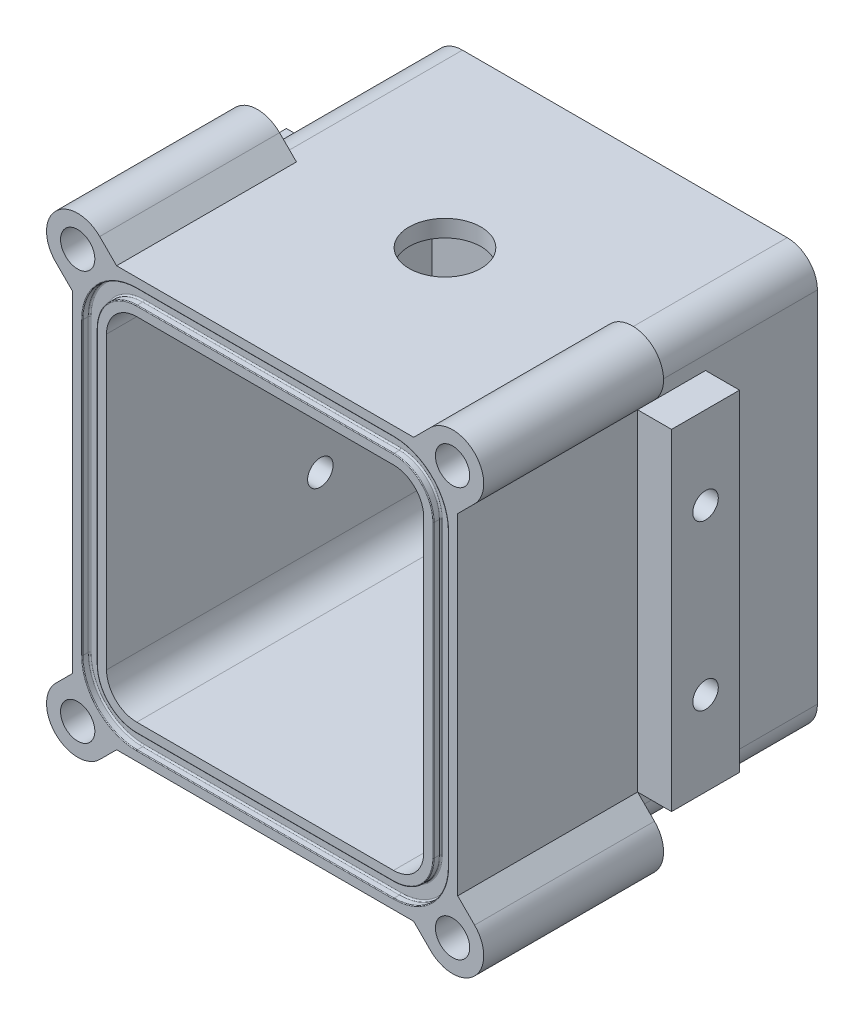
from build123d import *

# Parameters (mm, degrees)
BOSS_EXTRUDE1_DEPTH           = 31.75
SHELL1_T                      = -6
FILLET1_R                     = 5.334
CUT_EXTRUDE1_DEPTH            = 1.2954
FILLET2_R                     = 0.254
FILLET3_R                     = 0.127
BOSS_EXTRUDE2_DEPTH           = 31.75
SKETCH4_R                     = 3.025
CUT_EXTRUDE2_DEPTH            = 9
MIRROR2_COPY_1_DEPTH          = 31.75
MIRROR2_COPY_2_SKETCH_R       = 3.025
MIRROR2_COPY_2_DEPTH          = 9
SKETCH6_R                     = 6.35
CUT_EXTRUDE3_DEPTH            = 6
CUT_EXTRUDE4_START            = -3
SKETCH7_R                     = 11.43
SKETCH7_R_2                   = 6.35
CUT_EXTRUDE4_DEPTH            = 3
BOSS_EXTRUDE3_DEPTH           = 6
SKETCH9_R                     = 2
CUT_EXTRUDE5_DEPTH            = 4
SKETCH11_W                    = 2.25
SKETCH11_H                    = 76
M4_CLEARANCE_HOLE1_AT_2_COUNT = 2
M4_CLEARANCE_HOLE1_AT_2_PITCH = 28.96399232


with BuildPart() as part:
    # Sketch1 → Boss-Extrude1 (new, symmetric)
    with BuildSketch(Plane.XY):
        Polygon((-34, -37), (-34, -16.68), (-34, 16.68), (-34, 37), (34, 37), (34, -37), align=None)
    extrude(amount=BOSS_EXTRUDE1_DEPTH, both=True)

    # Shell1
    shell1_openings = [part.faces().sort_by_distance(p)[0] for p in [
        (0, 0, 31.75),
    ]]
    offset(amount=SHELL1_T, openings=shell1_openings, kind=Kind.INTERSECTION)

    # Fillet1
    fillet1_edges = [part.edges().sort_by_distance(p)[0] for p in [
        (34, 37, 0),
        (34, -37, 0),
        (-34, -37, 0),
        (-34, 37, 0),
        (28, 31, 3),
        (28, -31, 3),
        (-28, -31, 3),
        (-28, 31, 3),
    ]]
    fillet(fillet1_edges, radius=FILLET1_R)

    # Sketch2 → Cut-Extrude1 (cut)
    with BuildSketch(Plane.XY.offset(31.75)):
        with BuildLine():
            Line((32.2827, -25.666), (32.2827, 25.666))
            ThreePointArc((32.2827, 25.666), (29.466033783, 32.466033783), (22.666, 35.2827))
            Line((22.666, 35.2827), (-22.666, 35.2827))
            ThreePointArc((-22.666, 35.2827), (-29.466033783, 32.466033783), (-32.2827, 25.666))
            Line((-32.2827, 25.666), (-32.2827, -25.666))
            ThreePointArc((-32.2827, -25.666), (-29.466033783, -32.466033783), (-22.666, -35.2827))
            Line((-22.666, -35.2827), (22.666, -35.2827))
            ThreePointArc((22.666, -35.2827), (29.466033783, -32.466033783), (32.2827, -25.666))
        make_face()
        with BuildLine():
            Line((-29.7173, 25.666), (-29.7173, -25.666))
            ThreePointArc((-29.7173, -25.666), (-27.652022046, -30.652022046), (-22.666, -32.7173))
            Line((-22.666, -32.7173), (22.666, -32.7173))
            ThreePointArc((22.666, -32.7173), (27.652022046, -30.652022046), (29.7173, -25.666))
            Line((29.7173, -25.666), (29.7173, 25.666))
            ThreePointArc((29.7173, 25.666), (27.652022046, 30.652022046), (22.666, 32.7173))
            Line((22.666, 32.7173), (-22.666, 32.7173))
            ThreePointArc((-22.666, 32.7173), (-27.652022046, 30.652022046), (-29.7173, 25.666))
        make_face(mode=Mode.SUBTRACT)
    extrude(amount=-CUT_EXTRUDE1_DEPTH, mode=Mode.SUBTRACT)

    # Fillet2
    fillet2_edges = [part.edges().sort_by_distance(p)[0] for p in [
        (27.652022046, -30.652022046, 30.4546),
        (0, -32.7173, 30.4546),
        (-27.652022046, -30.652022046, 30.4546),
        (-29.7173, 0, 30.4546),
        (-27.652022046, 30.652022046, 30.4546),
        (0, 32.7173, 30.4546),
        (27.652022046, 30.652022046, 30.4546),
        (-29.466033783, 32.466033783, 30.4546),
        (0, 35.2827, 30.4546),
        (29.466033783, 32.466033783, 30.4546),
        (32.2827, 0, 30.4546),
        (29.466033783, -32.466033783, 30.4546),
        (0, -35.2827, 30.4546),
        (-29.466033783, -32.466033783, 30.4546),
        (29.7173, 0, 30.4546),
        (-32.2827, 0, 30.4546),
    ]]
    fillet(fillet2_edges, radius=FILLET2_R)

    # Fillet3
    fillet3_edges = [part.edges().sort_by_distance(p)[0] for p in [
        (-29.466033783, -32.466033783, 31.75),
        (-32.2827, 0, 31.75),
        (-29.466033783, 32.466033783, 31.75),
        (0, 35.2827, 31.75),
        (29.466033783, 32.466033783, 31.75),
        (32.2827, 0, 31.75),
        (29.466033783, -32.466033783, 31.75),
        (-27.652022046, -30.652022046, 31.75),
        (-29.7173, 0, 31.75),
        (-27.652022046, 30.652022046, 31.75),
        (0, 32.7173, 31.75),
        (27.652022046, 30.652022046, 31.75),
        (29.7173, 0, 31.75),
        (27.652022046, -30.652022046, 31.75),
        (0, -35.2827, 31.75),
        (0, -32.7173, 31.75),
    ]]
    fillet(fillet3_edges, radius=FILLET3_R)

    # Sketch3 → Boss-Extrude2 (add)
    with BuildSketch(Plane.XY.offset(31.75)):
        with BuildLine():
            ThreePointArc((30.741024965, -31.118858104), (29.555836344, -32.555836344), (28.118858104, -33.741024965))
            ThreePointArc((28.118858104, -33.741024965), (27.643498403, -35.335928432), (27.666944752, -37))
            Line((27.666944752, -37), (26.221825407, -37))
            Line((26.221825407, -37), (29.202282953, -39.980457546))
            ThreePointArc((29.202282953, -39.980457546), (36.980457546, -39.980457546), (36.980457546, -32.202282953))
            Line((36.980457546, -32.202282953), (34, -29.221825407))
            Line((34, -29.221825407), (34, -30.666944752))
            ThreePointArc((34, -30.666944752), (32.335928432, -30.643498403), (30.741024965, -31.118858104))
        make_face()
    boss_extrude2 = extrude(amount=-BOSS_EXTRUDE2_DEPTH)

    # Sketch4 → Cut-Extrude2 (cut)
    with BuildSketch(Plane.XY.offset(31.75)):
        with Locations((33.09137025, -36.09137025)):
            Circle(SKETCH4_R)
    cut_extrude2 = extrude(amount=-CUT_EXTRUDE2_DEPTH, mode=Mode.SUBTRACT)

    # Mirror1: Boss-Extrude2, Cut-Extrude2 across plane
    add(boss_extrude2.mirror(Plane.ZX))
    add(cut_extrude2.mirror(Plane.ZX), mode=Mode.SUBTRACT)

    # Mirror2: Boss-Extrude2, Cut-Extrude2 across plane
    add(boss_extrude2.mirror(Plane(origin=(0, 0, 0), x_dir=(0, 0, 1), z_dir=(1, 0, 0))))
    add(cut_extrude2.mirror(Plane(origin=(0, 0, 0), x_dir=(0, 0, 1), z_dir=(1, 0, 0))), mode=Mode.SUBTRACT)

    # Mirror2 copy 1 sketch → Mirror2 copy 1 (add)
    with BuildSketch(Plane(origin=(0, 0, 31.75), x_dir=(-1, 0, 0), z_dir=(0, 0, 1))):
        with BuildLine():
            ThreePointArc((30.741024965, -31.118858104), (29.555836344, -32.555836344), (28.118858104, -33.741024965))
            ThreePointArc((28.118858104, -33.741024965), (27.643498403, -35.335928432), (27.666944752, -37))
            Line((27.666944752, -37), (26.221825407, -37))
            Line((26.221825407, -37), (29.202282953, -39.980457546))
            ThreePointArc((29.202282953, -39.980457546), (36.980457546, -39.980457546), (36.980457546, -32.202282953))
            Line((36.980457546, -32.202282953), (34, -29.221825407))
            Line((34, -29.221825407), (34, -30.666944752))
            ThreePointArc((34, -30.666944752), (32.335928432, -30.643498403), (30.741024965, -31.118858104))
        make_face()
    extrude(amount=-MIRROR2_COPY_1_DEPTH)

    # Mirror2 copy 2 sketch → Mirror2 copy 2 (cut)
    with BuildSketch(Plane(origin=(0, 0, 31.75), x_dir=(-1, 0, 0), z_dir=(0, 0, 1))):
        with Locations((33.09137025, -36.09137025)):
            Circle(MIRROR2_COPY_2_SKETCH_R)
    extrude(amount=-MIRROR2_COPY_2_DEPTH, mode=Mode.SUBTRACT)

    # Sketch6 → Cut-Extrude3 (cut)
    with BuildSketch(Plane(origin=(0, 37, 0), x_dir=(1, 0, 0), z_dir=(0, 1, 0))):
        Circle(SKETCH6_R)
    extrude(amount=-CUT_EXTRUDE3_DEPTH, mode=Mode.SUBTRACT)

    # Sketch7 → Cut-Extrude4 (cut)
    with BuildSketch(Plane.XZ.offset(-31).offset(CUT_EXTRUDE4_START)):
        Circle(SKETCH7_R)
        Circle(SKETCH7_R_2, mode=Mode.SUBTRACT)
    extrude(amount=CUT_EXTRUDE4_DEPTH, mode=Mode.SUBTRACT)

    # Sketch8 → Boss-Extrude3 (add)
    with BuildSketch(Plane.ZY.offset(34)):
        Polygon((0, 0), (0, 29.221825407), (-12, 29.221825407), (-12, -29.221825407), (0, -29.221825407), align=None)
    boss_extrude3 = extrude(amount=BOSS_EXTRUDE3_DEPTH)

    # Sketch9 → Cut-Extrude5 (cut)
    with BuildSketch(Plane.ZY.offset(40)):
        with Locations((-6, 14.610912703)):
            Circle(SKETCH9_R)
        with Locations((-6, -14.353079617)):
            Circle(SKETCH9_R)
    cut_extrude5 = extrude(amount=-CUT_EXTRUDE5_DEPTH, mode=Mode.SUBTRACT)

    # Mirror5: Boss-Extrude3 across plane
    add(boss_extrude3.mirror(Plane(origin=(0, 0, 0), x_dir=(0, 0, 1), z_dir=(1, 0, 0))))

    # Mirror6: Cut-Extrude5 across plane
    add(cut_extrude5.mirror(Plane(origin=(0, 0, 0), x_dir=(0, 0, 1), z_dir=(1, 0, 0))), mode=Mode.SUBTRACT)

    # Sketch11 → M4 Clearance Hole1 (revolve, cut)
    with BuildSketch(Plane(origin=(-36, 14.610912703, -6), x_dir=(0, 0, 1), z_dir=(0, 1, 0))):
        with Locations((1.125, 38)):
            Rectangle(SKETCH11_W, SKETCH11_H)
    m4_clearance_hole1 = revolve(axis=Axis((-42.35, 14.610912703, -6), (1, 0, 0)), mode=Mode.SUBTRACT)

    # M4 Clearance Hole1 at 2: M4 Clearance Hole1 ×2
    with Locations(*[(0, -i * M4_CLEARANCE_HOLE1_AT_2_PITCH, 0) for i in range(1, M4_CLEARANCE_HOLE1_AT_2_COUNT)]):
        add(m4_clearance_hole1, mode=Mode.SUBTRACT)


solid = part.part
